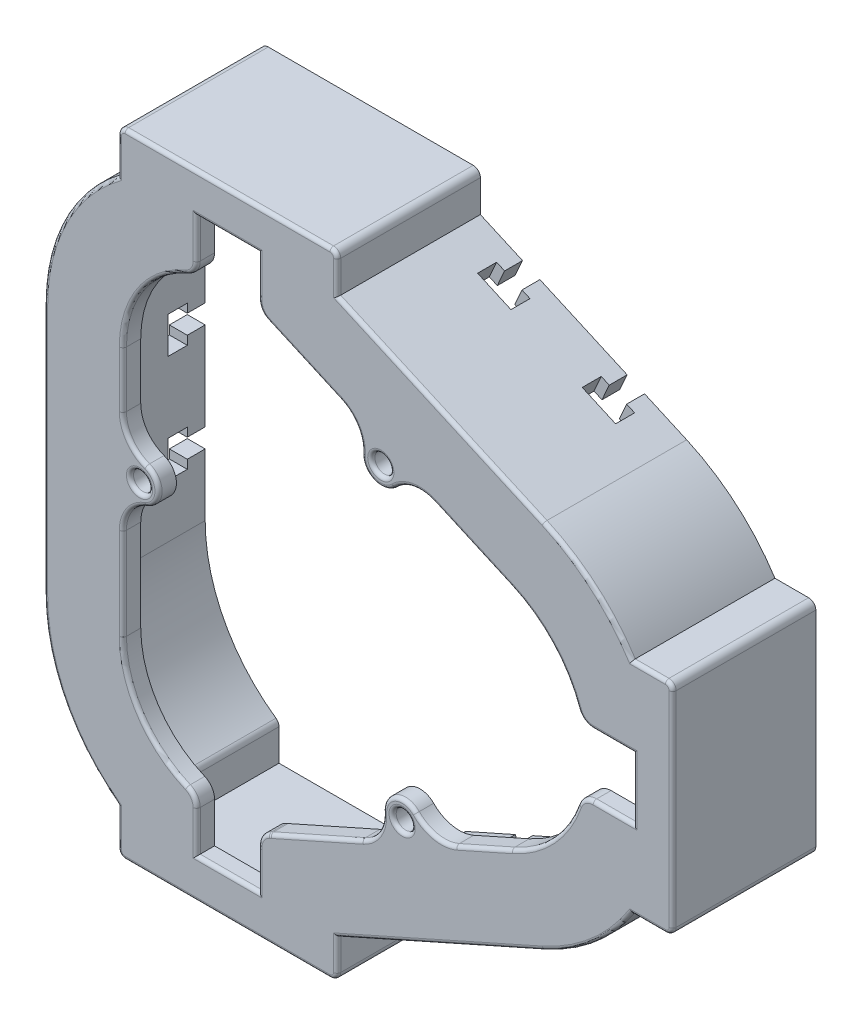
from build123d import *

# Parameters (mm, degrees)
SKETCH1_R           = 3.3782
BOSS_EXTRUDE1_DEPTH = 6.35
BOSS_EXTRUDE2_DEPTH = 50.8
CUT_EXTRUDE1_DEPTH  = 18.542
CUT_EXTRUDE2_DEPTH  = 18.542
FILLET1_R           = 12.7
FILLET2_R           = 2.54
FILLET3_R           = 1.27


with BuildPart() as part:
    # Sketch1 → Boss-Extrude1 (new body)
    with BuildSketch(Plane(origin=(0, 0, -80.01), x_dir=(-1, 0, 0), z_dir=(0, 0, -1))):
        with BuildLine():
            ThreePointArc((57.033048569, -59.752507142), (76.310939467, -36.760445876), (83.226798569, -7.563821901))
            Line((83.226798569, -7.563821901), (83.226798569, 81.336178099))
            ThreePointArc((83.226798569, 81.336178099), (76.310939467, 110.532802074), (57.033048569, 133.52486334))
            Line((57.033048569, 133.52486334), (57.033048569, 149.139312576))
            Line((57.033048569, 149.139312576), (-20.754451431, 149.139312576))
            Line((-20.754451431, 149.139312576), (-20.754451431, 135.265698217))
            Line((-20.754451431, 135.265698217), (-93.957455774, 102.667693744))
            ThreePointArc((-93.957455774, 102.667693744), (-111.579245978, 91.514788164), (-125.266063418, 75.779928099))
            Line((-125.266063418, 75.779928099), (-139.75728746, 75.779928099))
            Line((-139.75728746, 75.779928099), (-139.75728746, -2.007571901))
            Line((-139.75728746, -2.007571901), (-125.266063418, -2.007571901))
            ThreePointArc((-125.266063418, -2.007571901), (-111.579245978, -17.742431966), (-93.957455774, -28.895337546))
            Line((-93.957455774, -28.895337546), (-20.754451431, -61.493342019))
            Line((-20.754451431, -61.493342019), (-20.754451431, -75.366956378))
            Line((-20.754451431, -75.366956378), (57.033048569, -75.366956378))
            Line((57.033048569, -75.366956378), (57.033048569, -59.752507142))
        make_face()
        with BuildLine():
            Line((55.286798569, 39.965228132), (55.286798569, -7.563821901))
            ThreePointArc((55.286798569, -7.563821901), (49.095548569, -28.097875134), (32.585548569, -41.787243956))
            ThreePointArc((32.585548569, -41.787243956), (30.045548569, -43.893300698), (29.093048569, -47.052385811))
            Line((29.093048569, -47.052385811), (29.093048569, -61.396956378))
            Line((29.093048569, -61.396956378), (7.185548569, -61.396956378))
            Line((7.185548569, -61.396956378), (7.185548569, -47.052385811))
            ThreePointArc((7.185548569, -47.052385811), (6.233048569, -43.893300698), (3.693048569, -41.787243956))
            ThreePointArc((3.693048569, -41.787243956), (3.359698295, -41.6446108), (3.027756074, -41.498730766))
            Line((3.027756074, -41.498730766), (-43.20886125, -20.909118743))
            ThreePointArc((-43.20886125, -20.909118743), (-41.056532995, -8.006979176), (-49.205885333, -18.238586029))
            Line((-49.205885333, -18.238586029), (-82.591509282, -3.371645409))
            ThreePointArc((-82.591509282, -3.371645409), (-97.010075674, 6.955786784), (-106.189719626, 22.130932563))
            ThreePointArc((-106.189719626, 22.130932563), (-108.278986772, 24.886309283), (-111.574858962, 25.932428099))
            Line((-111.574858962, 25.932428099), (-125.78728746, 25.932428099))
            Line((-125.78728746, 25.932428099), (-125.78728746, 47.839928099))
            Line((-125.78728746, 47.839928099), (-111.574858962, 47.839928099))
            ThreePointArc((-111.574858962, 47.839928099), (-108.278986772, 48.886046915), (-106.189719626, 51.641423635))
            ThreePointArc((-106.189719626, 51.641423635), (-97.010075674, 66.816569414), (-82.591509282, 77.144001607))
            Line((-82.591509282, 77.144001607), (-41.755458339, 95.328689287))
            ThreePointArc((-41.755458339, 95.328689287), (-33.488036391, 85.259115367), (-35.440943929, 98.140603509))
            Line((-35.440943929, 98.140603509), (3.027756074, 115.271086964))
            ThreePointArc((3.027756074, 115.271086964), (3.359698295, 115.416966998), (3.693048569, 115.559600155))
            ThreePointArc((3.693048569, 115.559600155), (6.233048569, 117.665656896), (7.185548569, 120.824742009))
            Line((7.185548569, 120.824742009), (7.185548569, 135.169312576))
            Line((7.185548569, 135.169312576), (29.093048569, 135.169312576))
            Line((29.093048569, 135.169312576), (29.093048569, 120.824742009))
            ThreePointArc((29.093048569, 120.824742009), (30.045548569, 117.665656896), (32.585548569, 115.559600155))
            ThreePointArc((32.585548569, 115.559600155), (49.095548569, 101.870231332), (55.286798569, 81.336178099))
            Line((55.286798569, 81.336178099), (55.286798569, 46.52998577))
            ThreePointArc((55.286798569, 46.52998577), (42.624898569, 43.247606951), (55.286798569, 39.965228132))
        make_face(mode=Mode.SUBTRACT)
        with Locations((49.381298569, 43.247606951)):
            Circle(SKETCH1_R, mode=Mode.SUBTRACT)
        with Locations((-43.80502551, -14.179072002)):
            Circle(SKETCH1_R, mode=Mode.SUBTRACT)
        with Locations((-36.236528907, 91.431208193)):
            Circle(SKETCH1_R, mode=Mode.SUBTRACT)
    extrude(amount=BOSS_EXTRUDE1_DEPTH)

    # Sketch1<3> → Boss-Extrude2 (add)
    with BuildSketch(Plane(origin=(0, 0, -80.01), x_dir=(-1, 0, 0), z_dir=(0, 0, -1))):
        with BuildLine():
            ThreePointArc((57.033048569, -59.752507142), (76.310939467, -36.760445876), (83.226798569, -7.563821901))
            Line((83.226798569, -7.563821901), (83.226798569, 81.336178099))
            ThreePointArc((83.226798569, 81.336178099), (76.310939467, 110.532802074), (57.033048569, 133.52486334))
            Line((57.033048569, 133.52486334), (57.033048569, 149.139312576))
            Line((57.033048569, 149.139312576), (22.108048569, 149.139312576))
            Line((22.108048569, 149.139312576), (14.170548569, 149.139312576))
            Line((14.170548569, 149.139312576), (-20.754451431, 149.139312576))
            Line((-20.754451431, 149.139312576), (-20.754451431, 135.265698217))
            Line((-20.754451431, 135.265698217), (-93.957455774, 102.667693744))
            ThreePointArc((-93.957455774, 102.667693744), (-111.579245978, 91.514788164), (-125.266063418, 75.779928099))
            Line((-125.266063418, 75.779928099), (-139.75728746, 75.779928099))
            Line((-139.75728746, 75.779928099), (-139.75728746, 40.854928099))
            Line((-139.75728746, 40.854928099), (-139.75728746, 32.917428099))
            Line((-139.75728746, 32.917428099), (-139.75728746, -2.007571901))
            Line((-139.75728746, -2.007571901), (-125.266063418, -2.007571901))
            ThreePointArc((-125.266063418, -2.007571901), (-111.579245978, -17.742431966), (-93.957455774, -28.895337546))
            Line((-93.957455774, -28.895337546), (-20.754451431, -61.493342019))
            Line((-20.754451431, -61.493342019), (-20.754451431, -75.366956378))
            Line((-20.754451431, -75.366956378), (14.170548569, -75.366956378))
            Line((14.170548569, -75.366956378), (22.108048569, -75.366956378))
            Line((22.108048569, -75.366956378), (57.033048569, -75.366956378))
            Line((57.033048569, -75.366956378), (57.033048569, -59.752507142))
        make_face()
        with BuildLine():
            Line((76.876798569, 81.336178099), (76.876798569, -7.563821901))
            ThreePointArc((76.876798569, -7.563821901), (69.915897636, -35.299677671), (50.683048569, -56.46165664))
            Line((50.683048569, -56.46165664), (50.683048569, -69.016956378))
            Line((50.683048569, -69.016956378), (29.551735386, -69.016956378))
            Line((29.551735386, -69.016956378), (14.170548569, -69.016956378))
            Line((14.170548569, -69.016956378), (-14.404451431, -69.016956378))
            Line((-14.404451431, -69.016956378), (-14.404451431, -57.36990881))
            Line((-14.404451431, -57.36990881), (-91.374286117, -23.094498424))
            ThreePointArc((-91.374286117, -23.094498424), (-108.722690302, -11.79609352), (-121.690697129, 4.342428099))
            Line((-121.690697129, 4.342428099), (-133.40728746, 4.342428099))
            Line((-133.40728746, 4.342428099), (-133.40728746, 32.917428099))
            Line((-133.40728746, 32.917428099), (-133.40728746, 40.854928099))
            Line((-133.40728746, 40.854928099), (-133.40728746, 69.429928099))
            Line((-133.40728746, 69.429928099), (-121.690697129, 69.429928099))
            ThreePointArc((-121.690697129, 69.429928099), (-108.722690302, 85.568449718), (-91.374286117, 96.866854622))
            Line((-91.374286117, 96.866854622), (-14.404451431, 131.142265008))
            Line((-14.404451431, 131.142265008), (-14.404451431, 142.789312576))
            Line((-14.404451431, 142.789312576), (14.170548569, 142.789312576))
            Line((14.170548569, 142.789312576), (22.108048569, 142.789312576))
            Line((22.108048569, 142.789312576), (50.683048569, 142.789312576))
            Line((50.683048569, 142.789312576), (50.683048569, 130.234012838))
            ThreePointArc((50.683048569, 130.234012838), (69.915897636, 109.072033869), (76.876798569, 81.336178099))
        make_face(mode=Mode.SUBTRACT)
    extrude(amount=BOSS_EXTRUDE2_DEPTH)

    # Sketch3 → Cut-Extrude1 (cut)
    with BuildSketch(Plane(origin=(53.701665887, 120.593985576, 0), x_dir=(0.9135179719941336, -0.40679837124025636, 0), z_dir=(0.40679837124025636, 0.9135179719941336, 0))):
        Polygon((20.94203626, 130.81), (20.94203626, 124.46), (17.84323626, 124.46), (17.84323626, 117.7036), (30.79723626, 117.7036), (30.79723626, 124.46), (27.69843626, 124.46), (27.69843626, 130.81), align=None)
        Polygon((-19.69796374, 130.81), (-19.69796374, 124.46), (-22.79676374, 124.46), (-22.79676374, 117.7036), (-9.84276374, 117.7036), (-9.84276374, 124.46), (-12.94156374, 124.46), (-12.94156374, 130.81), align=None)
    cut_extrude1 = extrude(amount=-CUT_EXTRUDE1_DEPTH, mode=Mode.SUBTRACT)

    # Mirror1: Cut-Extrude1 across plane
    add(cut_extrude1.mirror(Plane.ZX.offset(36.886178099)), mode=Mode.SUBTRACT)

    # Sketch2 → Cut-Extrude2 (cut)
    with BuildSketch(Plane.ZY.offset(83.226798569)):
        Polygon((-130.81, 395.457978099), (-130.81, 402.214378099), (-124.46, 402.214378099), (-124.46, 405.313178099), (-117.602, 405.313178099), (-117.602, 392.359178099), (-124.46, 392.359178099), (-124.46, 395.457978099), align=None)
        Polygon((-130.81, 52.557978099), (-124.46, 52.557978099), (-124.46, 49.459178099), (-117.602, 49.459178099), (-117.602, 62.413178099), (-124.46, 62.413178099), (-124.46, 59.314378099), (-130.81, 59.314378099), align=None)
        Polygon((-130.81, 14.457978099), (-124.46, 14.457978099), (-124.46, 11.359178099), (-117.602, 11.359178099), (-117.602, 24.313178099), (-124.46, 24.313178099), (-124.46, 21.214378099), (-130.81, 21.214378099), align=None)
        Polygon((-130.81, 433.557978099), (-130.81, 440.314378099), (-124.46, 440.314378099), (-124.46, 443.413178099), (-117.602, 443.413178099), (-117.602, 430.459178099), (-124.46, 430.459178099), (-124.46, 433.557978099), align=None)
    extrude(amount=-CUT_EXTRUDE2_DEPTH, mode=Mode.SUBTRACT)

    # Fillet1
    fillet1_edges = [part.edges().sort_by_distance(p)[0] for p in [
        (49.205885333, -18.238586029, -83.185),
        (43.20886125, -20.909118743, -83.185),
        (-55.286798569, 46.52998577, -83.185),
        (-55.286798569, 39.965228132, -83.185),
        (41.755458339, 95.328689287, -83.185),
        (35.440943929, 98.140603509, -83.185),
    ]]
    fillet(fillet1_edges, radius=FILLET1_R)

    # Fillet2
    fillet2_edges = [part.edges().sort_by_distance(p)[0] for p in [
        (133.40728746, 69.429928099, -108.585),
        (133.40728746, 4.342428099, -108.585),
        (14.404451431, 142.789312576, -108.585),
        (-50.683048569, 142.789312576, -108.585),
        (14.404451431, 131.142265008, -108.585),
        (-50.683048569, 130.234012838, -108.585),
        (14.404451431, -57.36990881, -108.585),
        (-50.683048569, -56.46165664, -108.585),
        (20.754451431, -75.366956378, -105.41),
        (-57.033048569, -75.366956378, -105.41),
        (-57.033048569, 149.139312576, -105.41),
        (20.754451431, 149.139312576, -105.41),
        (139.75728746, 75.779928099, -105.41),
        (139.75728746, -2.007571901, -105.41),
        (121.690697129, 4.342428099, -108.585),
        (121.690697129, 69.429928099, -108.585),
    ]]
    fillet(fillet2_edges, radius=FILLET2_R)

    # Fillet3
    fillet3_edges = [part.edges().sort_by_distance(p)[0] for p in [
        (-56.289099793, -74.623007602, -80.01),
        (-57.033048569, -66.28973176, -80.01),
        (-76.310939467, -36.760445876, -80.01),
        (-83.226798569, 36.886178099, -80.01),
        (-76.310939467, 110.532802074, -80.01),
        (-57.033048569, 140.062087958, -80.01),
        (-56.289099793, 148.3953638, -80.01),
        (-18.139298569, 149.139312576, -80.01),
        (20.010502655, 148.3953638, -80.01),
        (20.754451431, 140.932505396, -80.01),
        (57.355953602, 118.966695981, -80.01),
        (111.579245978, 91.514788164, -80.01),
        (131.241675439, 75.779928099, -80.01),
        (139.013338684, 75.035979323, -80.01),
        (139.75728746, 36.886178099, -80.01),
        (139.013338684, -1.263623125, -80.01),
        (131.241675439, -2.007571901, -80.01),
        (111.579245978, -17.742431966, -80.01),
        (57.355953602, -45.194339782, -80.01),
        (20.754451431, -67.160149198, -80.01),
        (20.010502655, -74.623007602, -80.01),
        (-18.139298569, -75.366956378, -80.01),
        (39.614728907, 91.431208193, -80.01),
        (-46.003098569, 43.247606951, -80.01),
        (47.18322551, -14.179072002, -80.01),
        (118.681073211, 47.839928099, -80.01),
        (108.278986772, 48.886046915, -80.01),
        (97.010075674, 66.816569414, -80.01),
        (68.905076481, 83.23870225, -80.01),
        (47.711951698, 90.214222371, -80.01),
        (33.488036391, 85.259115367, -80.01),
        (27.654618084, 99.145946645, -80.01),
        (9.475001257, 109.703488434, -80.01),
        (-3.359698295, 115.416966998, -80.01),
        (-6.233048569, 117.665656896, -80.01),
        (-7.185548569, 127.997027293, -80.01),
        (-18.139298569, 135.169312576, -80.01),
        (-29.093048569, 127.997027293, -80.01),
        (-30.045548569, 117.665656896, -80.01),
        (-49.095548569, 101.870231332, -80.01),
        (-55.286798569, 71.407624403, -80.01),
        (-53.017885837, 54.234595681, -80.01),
        (-42.624898569, 43.247606951, -80.01),
        (-53.017885837, 32.260618221, -80.01),
        (-55.286798569, 8.726160647, -80.01),
        (-49.095548569, -28.097875134, -80.01),
        (-30.045548569, -43.893300698, -80.01),
        (-29.093048569, -54.224671095, -80.01),
        (-18.139298569, -61.396956378, -80.01),
        (-7.185548569, -54.224671095, -80.01),
        (-6.233048569, -43.893300698, -80.01),
        (-3.359698295, -41.6446108, -80.01),
        (13.26242371, -34.244556457, -80.01),
        (35.247571624, -21.970648949, -80.01),
        (41.056532995, -8.006979176, -80.01),
        (55.321194951, -13.031670708, -80.01),
        (72.726826185, -7.764484017, -80.01),
        (97.010075674, 6.955786784, -80.01),
        (108.278986772, 24.886309283, -80.01),
        (118.681073211, 25.932428099, -80.01),
        (125.78728746, 36.886178099, -80.01),
    ]]
    fillet(fillet3_edges, radius=FILLET3_R)


solid = part.part
